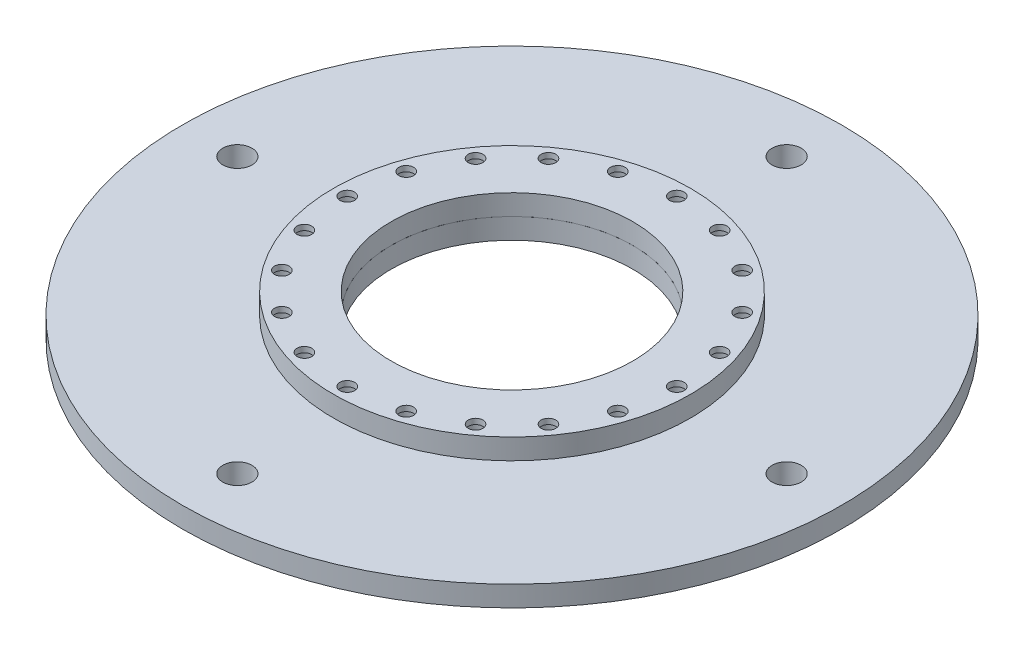
from build123d import *

# Parameters (mm, degrees)
SKETCH9_R                           = 82.55
SKETCH9_R_2                         = 55.88
REF_BACKPLATE_DEPTH                 = 9.525
REF_CBORE_BACKPLATE_D               = 6.7564
REF_CBORE_BACKPLATE_CBORE_D         = 11.176
REF_CBORE_BACKPLATE_CBORE_DEPTH     = 6.985
REF_CBORE_BACKPLATE_PATTERN_COUNT   = 20
SKETCH1_R                           = 152.4
SKETCH1_R_2                         = 55.88
THRUSTPLATE_TC3_DEPTH               = 9.525
SKETCH12_W                          = 6.74624
SKETCH12_H                          = 9.525
CLEARANCE_THRUSTPLATE_PATTERN_COUNT = 4
SKETCH23_W                          = 2.5527
SKETCH23_H                          = 9.525
CIRPATTERN1_COUNT                   = 10


with BuildPart() as part:
    # Sketch9 → REF_BackPlate (new body)
    with BuildSketch(Plane(origin=(0, 0, 0), x_dir=(1, 0, 0), z_dir=(0, 1, 0))):
        Circle(SKETCH9_R)
        Circle(SKETCH9_R_2, mode=Mode.SUBTRACT)
    extrude(amount=REF_BACKPLATE_DEPTH)

    # REF_CBORE_BackPlate (through all)
    with Locations(Plane(origin=(0, 0, 0), x_dir=(-1, 0, 0), z_dir=(0, -1, 0))):
        with Locations((0, 76.2)):
            ref_cbore_backplate = CounterBoreHole(REF_CBORE_BACKPLATE_D / 2, REF_CBORE_BACKPLATE_CBORE_D / 2, REF_CBORE_BACKPLATE_CBORE_DEPTH)

    # REF_CBORE_BackPlate_Pattern: REF_CBORE_BackPlate ×20 about axis
    ref_cbore_backplate_pattern_axis = Axis((0, 9.525, 0), (0, -1, 0))
    for i in range(1, REF_CBORE_BACKPLATE_PATTERN_COUNT):
        add(ref_cbore_backplate.rotate(ref_cbore_backplate_pattern_axis, i * 360 / REF_CBORE_BACKPLATE_PATTERN_COUNT), mode=Mode.SUBTRACT)


with BuildPart() as body_2:
    # Sketch1 → ThrustPlate_TC3 (new body)
    with BuildSketch(Plane(origin=(0, 0, 0), x_dir=(1, 0, 0), z_dir=(0, 1, 0))):
        Circle(SKETCH1_R)
        Circle(SKETCH1_R_2, mode=Mode.SUBTRACT)
    extrude(amount=-THRUSTPLATE_TC3_DEPTH)

    # Sketch12 → UNDEF_Clearance_ThrustPlate (revolve, cut)
    with BuildSketch(Plane(origin=(0, 0, -127), x_dir=(0, 0, 1), z_dir=(1, 0, 0))):
        with Locations((3.37312, 4.7625)):
            Rectangle(SKETCH12_W, SKETCH12_H)
    undef_clearance_thrustplate = revolve(axis=Axis((0, 6.35, -127), (0, -1, 0)), mode=Mode.SUBTRACT)

    # Clearance_ThrustPlate_Pattern: UNDEF_Clearance_ThrustPlate ×4 about axis
    clearance_thrustplate_pattern_axis = Axis((0, -9.525, 0), (0, 1, 0))
    for i in range(1, CLEARANCE_THRUSTPLATE_PATTERN_COUNT):
        add(undef_clearance_thrustplate.rotate(clearance_thrustplate_pattern_axis, i * 360 / CLEARANCE_THRUSTPLATE_PATTERN_COUNT), mode=Mode.SUBTRACT)

    # Sketch23 → #10 Clearance Hole1 (revolve, cut)
    with BuildSketch(Plane(origin=(0, 0, -70.32625), x_dir=(0, 0, 1), z_dir=(1, 0, 0))):
        with Locations((1.27635, 4.7625)):
            Rectangle(SKETCH23_W, SKETCH23_H)
    f_10_clearance_hole1 = revolve(axis=Axis((0, 6.35, -70.32625), (0, -1, 0)), mode=Mode.SUBTRACT)

    # CirPattern1: #10 Clearance Hole1 ×10 about axis
    cirpattern1_axis = Axis((0, -9.525, 0), (0, 1, 0))
    for i in range(1, CIRPATTERN1_COUNT):
        add(f_10_clearance_hole1.rotate(cirpattern1_axis, i * 360 / CIRPATTERN1_COUNT), mode=Mode.SUBTRACT)


solid = Compound([part.part, body_2.part])
